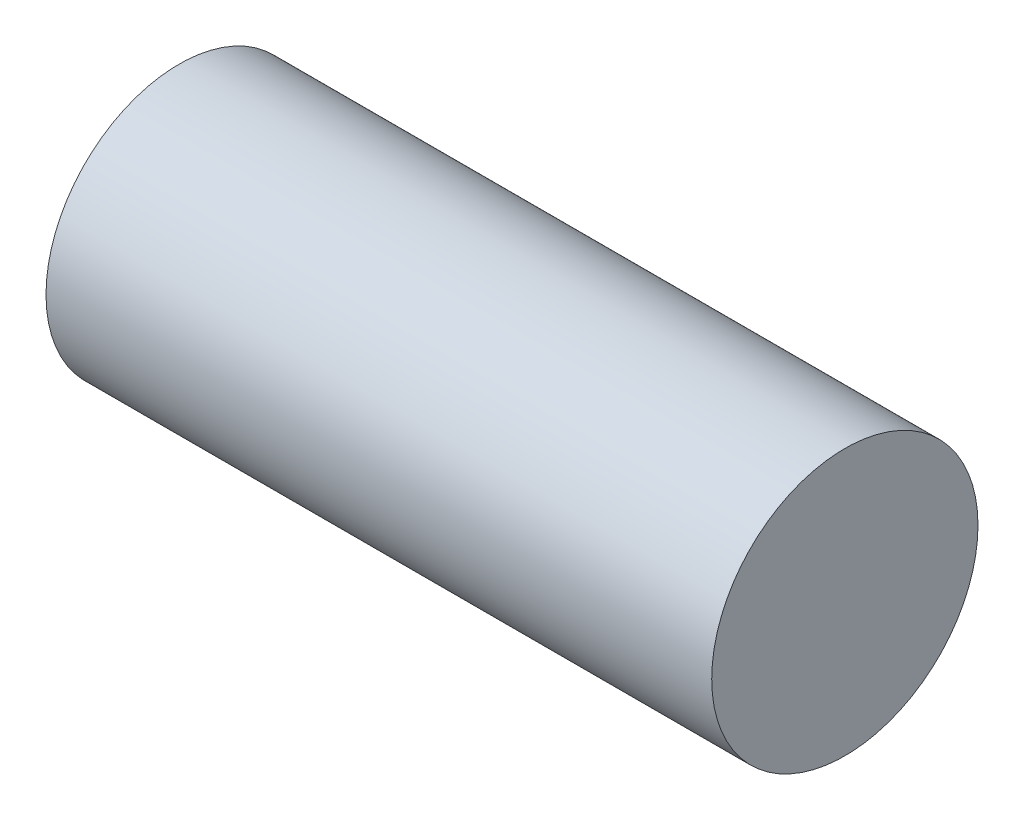
from build123d import *

# Parameters (mm, degrees)
SKETCH1_R           = 4
BOSS_EXTRUDE1_DEPTH = 20


with BuildPart() as part:
    # Sketch1 → Boss-Extrude1 (new body)
    with BuildSketch(Plane.YZ):
        Circle(SKETCH1_R)
    extrude(amount=BOSS_EXTRUDE1_DEPTH)


solid = part.part
